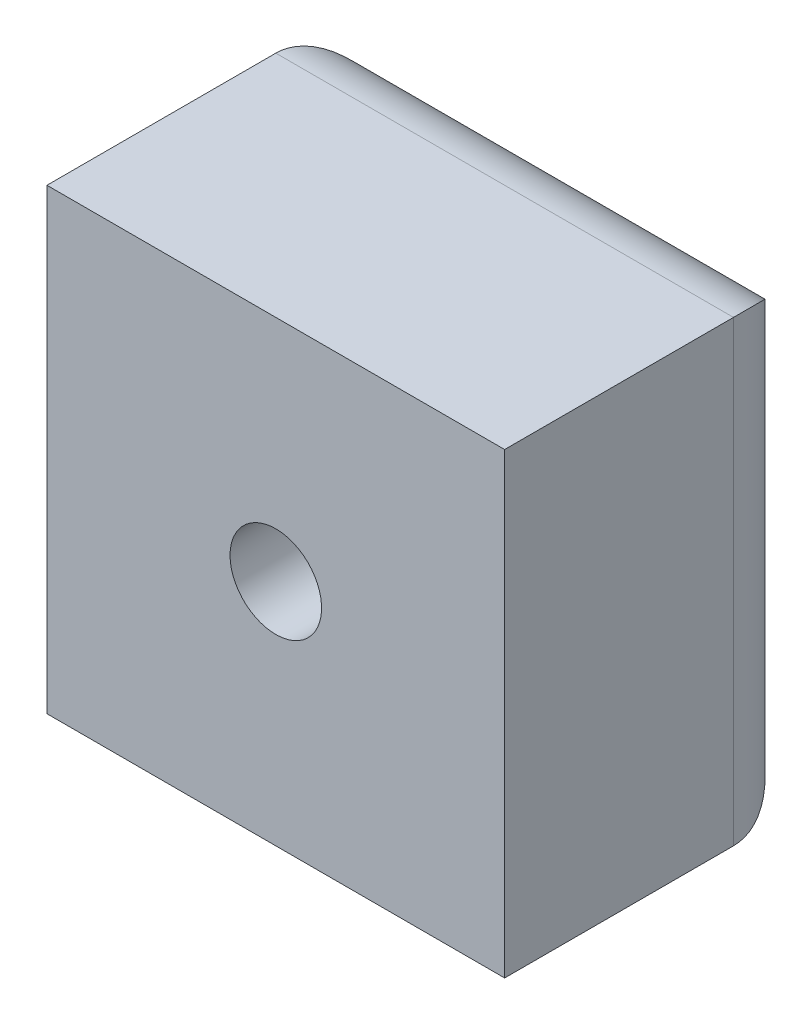
from build123d import *

# Parameters (mm, degrees)
SKETCH1_W             = 15
SKETCH1_H             = 15
BOSS_EXTRUDE1_DEPTH   = 10
FILLET2_R             = 2.5
M3X0_5_TAPPED_HOLE1_D = 3
SKETCH5_R             = 3
CUT_EXTRUDE1_DEPTH    = 6


with BuildPart() as part:
    # Sketch1 → Boss-Extrude1 (new body)
    with BuildSketch(Plane.XY):
        with Locations((7.5, 7.5)):
            Rectangle(SKETCH1_W, SKETCH1_H)
    extrude(amount=BOSS_EXTRUDE1_DEPTH)

    # Fillet2
    fillet2_edges = [part.edges().sort_by_distance(p)[0] for p in [
        (7.5, 0, 0),
        (15, 7.5, 0),
        (7.5, 15, 0),
        (0, 7.5, 0),
    ]]
    fillet(fillet2_edges, radius=FILLET2_R)

    # M3x0.5 Tapped Hole1 (through all)
    with Locations(Plane(origin=(0, 0, 0), x_dir=(-1, 0, 0), z_dir=(0, 0, -1))):
        with Locations((-7.5, 7.5)):
            Hole(M3X0_5_TAPPED_HOLE1_D / 2)

    # Sketch5 → Cut-Extrude1 (cut)
    with BuildSketch(Plane(origin=(0, 0, 0), x_dir=(-1, 0, 0), z_dir=(0, 0, -1))):
        with Locations((-7.5, 7.5)):
            Circle(SKETCH5_R)
    extrude(amount=-CUT_EXTRUDE1_DEPTH, mode=Mode.SUBTRACT)


solid = part.part
